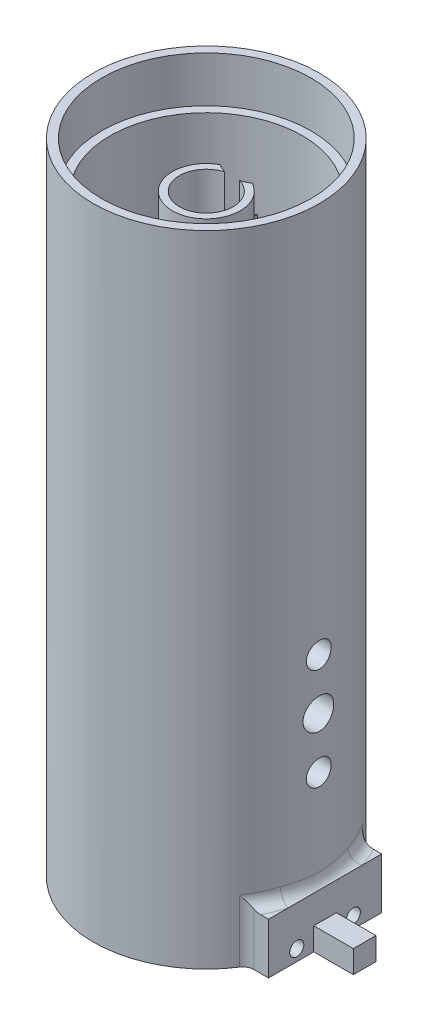
from build123d import *
from build123d.topology import SkipClean

# Parameters (mm, degrees)
SKETCH1_R               = 20
SKETCH1_R_2             = 12.625
BOSS_EXTRUDE1_DEPTH     = 60
SKETCH11_R              = 20
SKETCH11_R_2            = 17
BOSS_EXTRUDE4_DEPTH     = 45
SKETCH43_R              = 20
SKETCH43_R_2            = 18.5
BOSS_EXTRUDE11_DEPTH    = 8.1
SKETCH7_R               = 3.75
BOSS_EXTRUDE2_DEPTH     = 2.5
EXTRUDE_THIN2_DEPTH     = 30
CUT_EXTRUDE1_DEPTH      = 69.60211367
CUT_EXTRUDE1_DEPTH_BACK = 69.60211367
SKETCH10_R              = 1.625
CUT_EXTRUDE3_DEPTH      = 117.583060519
CUT_EXTRUDE3_DEPTH_BACK = 117.583060519
SKETCH15_R              = 2.7158
CUT_EXTRUDE7_REACH      = 118.583
CUT_EXTRUDE7_END_RADIUS = 20
SKETCH41_R              = 2.2
BOSS_EXTRUDE6_DEPTH     = 42.5
SKETCH32_R              = 2
CUT_EXTRUDE5_DEPTH      = 117.583060651
BOSS_EXTRUDE7_START     = 13
SKETCH38_W              = 20
SKETCH38_H              = 9
SKETCH38_R              = 1.25
BOSS_EXTRUDE7_DEPTH     = 8
FILLET1_R               = 2
CUT_EXTRUDE6_REACH      = 123.953
SKETCH39_R              = 1.25
SKETCH40_W              = 4
SKETCH40_H              = 4
BOSS_EXTRUDE8_DEPTH     = 7


# Read off the part's stored shape, not the designer's step: Boss-Extrude6
with BuildPart() as part:
    # Sketch1 → Boss-Extrude1 (new body)
    with BuildSketch(Plane(origin=(0, 0, 0), x_dir=(1, 0, 0), z_dir=(0, 1, 0))):
        with Locations(Location((0, 0, 0), (0, 0, 270))):
            Circle(SKETCH1_R)
        with Locations(Location((0, 0, 0), (0, 0, 270))):
            Circle(SKETCH1_R_2, mode=Mode.SUBTRACT)
    extrude(amount=BOSS_EXTRUDE1_DEPTH)

    # Sketch11 → Boss-Extrude4 (add)
    with BuildSketch(Plane(origin=(0, 60, 0), x_dir=(1, 0, 0), z_dir=(0, 1, 0))):
        with Locations(Location((0, 0, 0), (0, 0, 270))):
            Circle(SKETCH11_R)
        with Locations(Location((0, 0, 0), (0, 0, 90))):
            Circle(SKETCH11_R_2, mode=Mode.SUBTRACT)
    extrude(amount=BOSS_EXTRUDE4_DEPTH)

    # Sketch43 → Boss-Extrude11 (add)
    with BuildSketch(Plane(origin=(0, 105, 0), x_dir=(1, 0, 0), z_dir=(0, 1, 0))):
        with Locations(Location((0, 0, 0), (0, 0, 270))):
            Circle(SKETCH43_R)
        with Locations(Location((0, 0, 0), (0, 0, 270))):
            Circle(SKETCH43_R_2, mode=Mode.SUBTRACT)
    extrude(amount=BOSS_EXTRUDE11_DEPTH)

    # Sketch7 → Boss-Extrude2 (add)
    with BuildSketch(Plane(origin=(0, 60, 0), x_dir=(1, 0, 0), z_dir=(0, 1, 0))):
        with BuildLine():
            ThreePointArc((17, 0), (-12.02081528, 12.02081528), (0, -17))
            ThreePointArc((0, -17), (12.02081528, -12.02081528), (17, 0))
        make_face()
        with Locations(Location((0, 0, 0), (0, 0, 270))):
            Circle(SKETCH7_R, mode=Mode.SUBTRACT)
    extrude(amount=BOSS_EXTRUDE2_DEPTH)


with BuildPart() as body_2:
    # Sketch8 → Extrude-Thin2 (new body)
    with BuildSketch(Plane(origin=(0, 62.5, 0), x_dir=(1, 0, 0), z_dir=(0, 1, 0))):
        with BuildLine():
            ThreePointArc((-4.423664021, 13.453541246), (0, 3.4), (4.423664021, 13.453541246))
            Line((4.423664021, 13.453541246), (3.686386684, 12.777951038))
            ThreePointArc((3.686386684, 12.777951038), (0, 4.4), (-3.686386684, 12.777951038))
            Line((-3.686386684, 12.777951038), (-4.423664021, 13.453541246))
        make_face()
    extrude(amount=EXTRUDE_THIN2_DEPTH)


with BuildPart() as cut_extrude1_tool:
    # Sketch10 → Cut-Extrude1 (new, two sides: drawn at the far end of the back side and taken through both)
    with SkipClean():  # the faces are left unmerged after this step: merging them gives an invalid solid
        with BuildSketch(Plane(origin=(0, 62.5, 0), x_dir=(1, 0, 0), z_dir=(0, 1, 0)).offset(-CUT_EXTRUDE1_DEPTH_BACK)):
            with Locations(Location((-8.5, 0, 0), (0, 0, 270))):
                Circle(SKETCH10_R)
            with Locations(Location((8.5, 0, 0), (0, 0, 270))):
                Circle(SKETCH10_R)
            with BuildLine():
                Line((-4.423664021, 13.453541246), (-4.423664021, 16.414359465))
                ThreePointArc((-4.423664021, 16.414359465), (0, 17), (4.423664021, 16.414359465))
                Line((4.423664021, 16.414359465), (4.423664021, 13.453541246))
                Line((4.423664021, 13.453541246), (4.423664021, 11.730492787))
                ThreePointArc((4.423664021, 11.730492787), (0, 4.4), (-4.423664021, 11.730492787))
                Line((-4.423664021, 11.730492787), (-4.423664021, 13.453541246))
            make_face()
        extrude(amount=CUT_EXTRUDE1_DEPTH + CUT_EXTRUDE1_DEPTH_BACK)


with BuildPart() as part_1:
    with SkipClean():  # the faces are left unmerged after this step: merging them gives an invalid solid
        add(part.part)

        # Cut-Extrude1: cut by cut_extrude1_tool
        add(cut_extrude1_tool.part, mode=Mode.SUBTRACT)

    # Sketch15 → Cut-Extrude3 (cut, two sides: drawn at the far end of the back side and taken through both)
    with SkipClean():  # the faces are left unmerged after this step: merging them gives an invalid solid
        with BuildSketch(Plane(origin=(0, 0, 0), x_dir=(0, 0, -1), z_dir=(1, 0, 0)).offset(-CUT_EXTRUDE3_DEPTH_BACK)):
            with Locations((0, 35)):
                Circle(SKETCH15_R)
        extrude(amount=CUT_EXTRUDE3_DEPTH + CUT_EXTRUDE3_DEPTH_BACK, mode=Mode.SUBTRACT)

    # Cut-Extrude7: up to this cylinder (the profile starts inside it)
    with SkipClean():  # the faces are left unmerged after this step: merging them gives an invalid solid
        cut_extrude7_end = Plane(origin=(0, 35, 0), z_dir=(0, -1, 0)) * Cylinder(CUT_EXTRUDE7_END_RADIUS, 296.166, mode=Mode.PRIVATE)
        # Sketch41 → Cut-Extrude7 (cut, up to the surface)
        with BuildSketch(Plane(origin=(0, 0, 0), x_dir=(0, 0, -1), z_dir=(1, 0, 0)), mode=Mode.PRIVATE) as cut_extrude7_sk1:
            with Locations(Location((0, 44, 0), (0, 0, 180))):
                Circle(SKETCH41_R)
        cut_extrude7_tool1 = extrude(cut_extrude7_sk1.sketch, amount=CUT_EXTRUDE7_REACH, mode=Mode.PRIVATE) & cut_extrude7_end
        add(cut_extrude7_tool1.solids().sort_by_distance((0, 44, 0))[0], mode=Mode.SUBTRACT)
        # Sketch41 → Cut-Extrude7 (cut, up to the surface)
        with BuildSketch(Plane(origin=(0, 0, 0), x_dir=(0, 0, -1), z_dir=(1, 0, 0)), mode=Mode.PRIVATE) as cut_extrude7_sk2:
            with Locations(Location((0, 26, 0), (0, 0, 180))):
                Circle(SKETCH41_R)
        cut_extrude7_tool2 = extrude(cut_extrude7_sk2.sketch, amount=CUT_EXTRUDE7_REACH, mode=Mode.PRIVATE) & cut_extrude7_end
        add(cut_extrude7_tool2.solids().sort_by_distance((0, 26, 0))[0], mode=Mode.SUBTRACT)

    # Boss-Extrude6 outline → Boss-Extrude6 (add)
    with SkipClean():  # the faces are left unmerged after this step: merging them gives an invalid solid
        with BuildSketch(Plane(origin=(0, 62.5, 0), x_dir=(1, 0, 0), z_dir=(0, 1, 0))):
            with BuildLine():
                ThreePointArc((-1.317381103, 4.576670545), (-2.108832651, 4.866477655), (-2.840360984, 5.285106383))
                ThreePointArc((-2.840360984, 5.285106383), (0, -6), (2.840360984, 5.285106383))
                ThreePointArc((2.840360984, 5.285106383), (2.108832651, 4.866477655), (1.317381103, 4.576670545))
                ThreePointArc((1.317381103, 4.576670545), (0, -4.7625), (-1.317381103, 4.576670545))
            make_face()
        extrude(amount=BOSS_EXTRUDE6_DEPTH)

    # Sketch32 → Cut-Extrude5 (cut, through all)
    with SkipClean():  # the faces are left unmerged after this step: merging them gives an invalid solid
        with BuildSketch(Plane(origin=(0, 0, 0), x_dir=(0, 0, -1), z_dir=(1, 0, 0))):
            with Locations((0, 41.5)):
                Circle(SKETCH32_R)
            with Locations((0, 28.5)):
                Circle(SKETCH32_R)
        extrude(amount=-CUT_EXTRUDE5_DEPTH, mode=Mode.SUBTRACT)

    # Sketch38 → Boss-Extrude7 (add)
    with SkipClean():  # the faces are left unmerged after this step: merging them gives an invalid solid
        with BuildSketch(Plane(origin=(0, 0, 0), x_dir=(0, 0, -1), z_dir=(1, 0, 0)).offset(BOSS_EXTRUDE7_START)):
            with Locations((0, 4.5)):
                Rectangle(SKETCH38_W, SKETCH38_H)
            with Locations(Location((5, 2, 0), (0, 0, 180))):
                Circle(SKETCH38_R, mode=Mode.SUBTRACT)
            with Locations(Location((-5, 2, 0), (0, 0, 180))):
                Circle(SKETCH38_R, mode=Mode.SUBTRACT)
        extrude(amount=BOSS_EXTRUDE7_DEPTH)

    # Fillet1
    fillet1_edges = [part_1.edges().sort_by_distance(p)[0] for p in [
        (20, 9, 0),
        (17.320508076, 4.5, -10),
        (17.320508076, 4.5, 10),
    ]]
    fillet(fillet1_edges, radius=FILLET1_R)

    # Sketch39 → Cut-Extrude6 (cut, up to next)
    with BuildSketch(Plane(origin=(21, 0, 0), x_dir=(0, 0, -1), z_dir=(1, 0, 0)), mode=Mode.PRIVATE) as cut_extrude6_sk1:
        with Locations((5, 2)):
            Circle(SKETCH39_R)
    cut_extrude6_tool1 = extrude(cut_extrude6_sk1.sketch, amount=-CUT_EXTRUDE6_REACH, mode=Mode.PRIVATE) & part_1.part
    # Sketch39 → Cut-Extrude6 (cut, up to next)
    with BuildSketch(Plane(origin=(21, 0, 0), x_dir=(0, 0, -1), z_dir=(1, 0, 0)), mode=Mode.PRIVATE) as cut_extrude6_sk2:
        with Locations(Location((-5, 2, 0), (0, 0, 180))):
            Circle(SKETCH39_R)
    cut_extrude6_tool2 = extrude(cut_extrude6_sk2.sketch, amount=-CUT_EXTRUDE6_REACH, mode=Mode.PRIVATE) & part_1.part
    add(cut_extrude6_tool1.solids().sort_by_distance((21, 2, -5))[0], mode=Mode.SUBTRACT)
    add(cut_extrude6_tool2.solids().sort_by_distance((21, 2, 5))[0], mode=Mode.SUBTRACT)

    # Sketch40 → Boss-Extrude8 (add)
    with SkipClean():  # the faces are left unmerged after this step: merging them gives an invalid solid
        with BuildSketch(Plane(origin=(21, 0, 0), x_dir=(0, 0, -1), z_dir=(1, 0, 0))):
            with Locations((0, 2)):
                Rectangle(SKETCH40_W, SKETCH40_H)
        extrude(amount=BOSS_EXTRUDE8_DEPTH)


with BuildPart() as body_2_1:
    with SkipClean():  # the faces are left unmerged after this step: merging them gives an invalid solid
        add(body_2.part)

        # Cut-Extrude1: cut by cut_extrude1_tool
        add(cut_extrude1_tool.part, mode=Mode.SUBTRACT)


solid = Compound([part_1.part, body_2_1.part])
